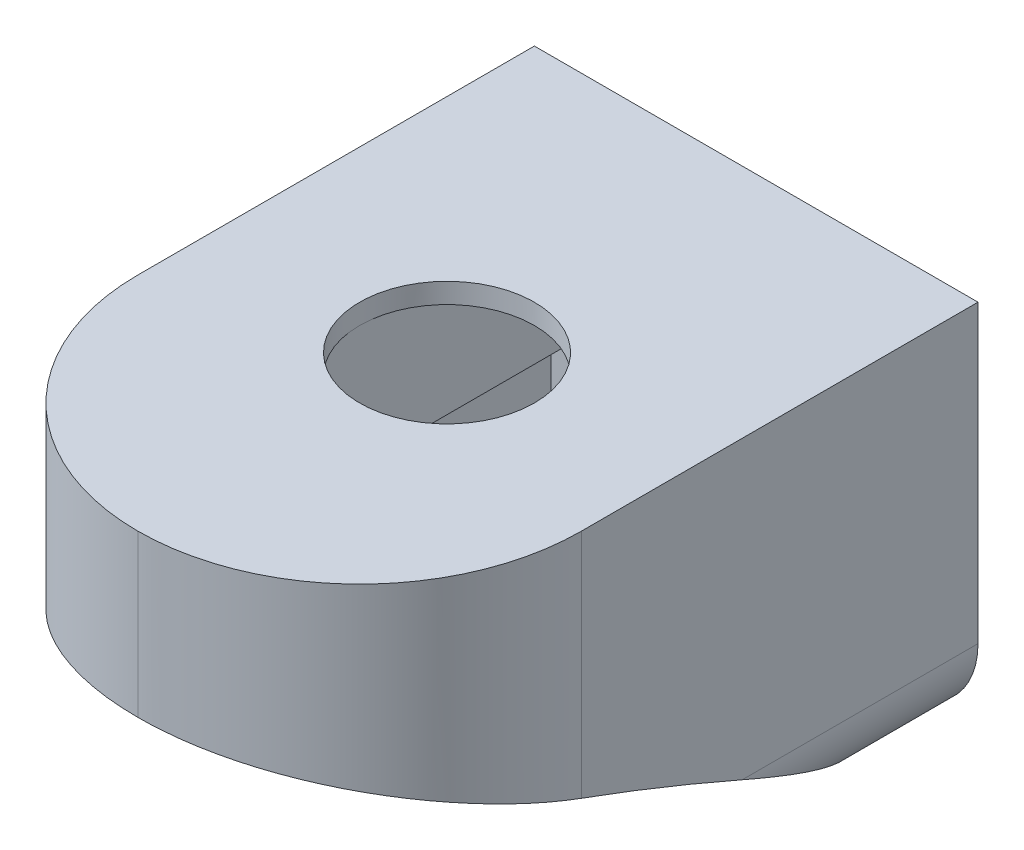
from build123d import *

# Parameters (mm, degrees)
SKETCH1_W           = 33
SKETCH1_H           = 28
BOSS_EXTRUDE1_DEPTH = 46
CUT_EXTRUDE1_DEPTH  = 46
CUT_EXTRUDE2_START  = -3
CUT_EXTRUDE2_DEPTH  = 27
FILLET2_R           = 12.5
FILLET3_R           = 16.5
FILLET4_R           = 6
SKETCH4_W           = 13
SKETCH4_H           = 23
CUT_EXTRUDE3_DEPTH  = 9
SKETCH5_R           = 6.5
CUT_EXTRUDE4_DEPTH  = 56.592265809
SKETCH6_R           = 1
CUT_EXTRUDE5_DEPTH  = 8
SKETCH7_R           = 1.3
SKETCH7_R_2         = 2.5
CUT_EXTRUDE6_DEPTH  = 1.769084801


with BuildPart() as part:
    # Sketch1 → Boss-Extrude1 (new body)
    with BuildSketch(Plane.XY):
        Rectangle(SKETCH1_W, SKETCH1_H)
    extrude(amount=BOSS_EXTRUDE1_DEPTH)

    # Sketch2 → Cut-Extrude1 (cut)
    with BuildSketch(Plane(origin=(16.5, 0, 0), x_dir=(0, 0, -1), z_dir=(1, 0, 0))):
        with BuildLine():
            Line((-46, 2), (-46, -14))
            Line((-46, -14), (-5, -14))
            add(Edge.make_bspline(
                [(-5, -14), (-24.751807392, -3.724011785), (-46, 2)],
                knots=[0, 0, 0, 1, 1, 1], degree=2))
        make_face()
    extrude(amount=-CUT_EXTRUDE1_DEPTH, mode=Mode.SUBTRACT)

    # Sketch3 → Cut-Extrude2 (cut)
    with BuildSketch(Plane(origin=(16.5, 0, 0), x_dir=(0, 0, -1), z_dir=(1, 0, 0)).offset(CUT_EXTRUDE2_START)):
        with BuildLine():
            Line((-5, -14), (-1.769084801, -14))
            Line((-1.769084801, -14), (-1.769084801, 3.5))
            Line((-1.769084801, 3.5), (-39.769084801, 3.5))
            Line((-39.769084801, 3.5), (-39.769084801, 0.213825967))
            add(Edge.make_bspline(
                [(-5, -14), (-21.840644779, -5.238560409), (-39.769084801, 0.213825967)],
                knots=[0, 0, 0, 1, 1, 1], degree=2))
        make_face()
    extrude(amount=-CUT_EXTRUDE2_DEPTH, mode=Mode.SUBTRACT)

    # Fillet2
    fillet2_edges = [part.edges().sort_by_distance(p)[0] for p in [
        (13.5, 1.856912984, 39.769084801),
        (-13.5, 1.856912984, 39.769084801),
    ]]
    fillet(fillet2_edges, radius=FILLET2_R)

    # Fillet3
    fillet3_edges = [part.edges().sort_by_distance(p)[0] for p in [
        (16.5, 8, 46),
        (-16.5, 8, 46),
    ]]
    fillet(fillet3_edges, radius=FILLET3_R - 0.0001)  # a hair under: the kernel refuses the full size

    # Fillet4
    fillet4_edges = [part.edges().sort_by_distance(p)[0] for p in [
        (-16.5, -14, 2.5),
        (16.5, -14, 2.5),
    ]]
    fillet(fillet4_edges, radius=FILLET4_R)

    # Sketch4 → Cut-Extrude3 (cut)
    with BuildSketch(Plane.XZ.offset(-3.5)):
        with Locations((0, 18)):
            Rectangle(SKETCH4_W, SKETCH4_H)
    extrude(amount=-CUT_EXTRUDE3_DEPTH, mode=Mode.SUBTRACT)

    # Sketch5 → Cut-Extrude4 (cut, through all)
    with BuildSketch(Plane.XZ.offset(-12.5)):
        with Locations((0, 23)):
            Circle(SKETCH5_R)
    extrude(amount=-CUT_EXTRUDE4_DEPTH, mode=Mode.SUBTRACT)

    # Sketch6 → Cut-Extrude5 (cut)
    with BuildSketch(Plane.XZ.offset(-3.5)):
        with Locations((0, 31.8)):
            Circle(SKETCH6_R)
        with Locations((0, 4.2)):
            Circle(SKETCH6_R)
    extrude(amount=-CUT_EXTRUDE5_DEPTH, mode=Mode.SUBTRACT)

    # Sketch7 → Cut-Extrude6 (cut)
    with BuildSketch(Plane(origin=(0, 0, 0), x_dir=(-1, 0, 0), z_dir=(0, 0, -1))):
        with Locations((-9.5, 0)):
            Circle(SKETCH7_R)
        with Locations((-5, 0)):
            Circle(SKETCH7_R_2)
        with Locations((-0.5, 0)):
            Circle(SKETCH7_R)
    extrude(amount=-CUT_EXTRUDE6_DEPTH, mode=Mode.SUBTRACT)


solid = part.part
